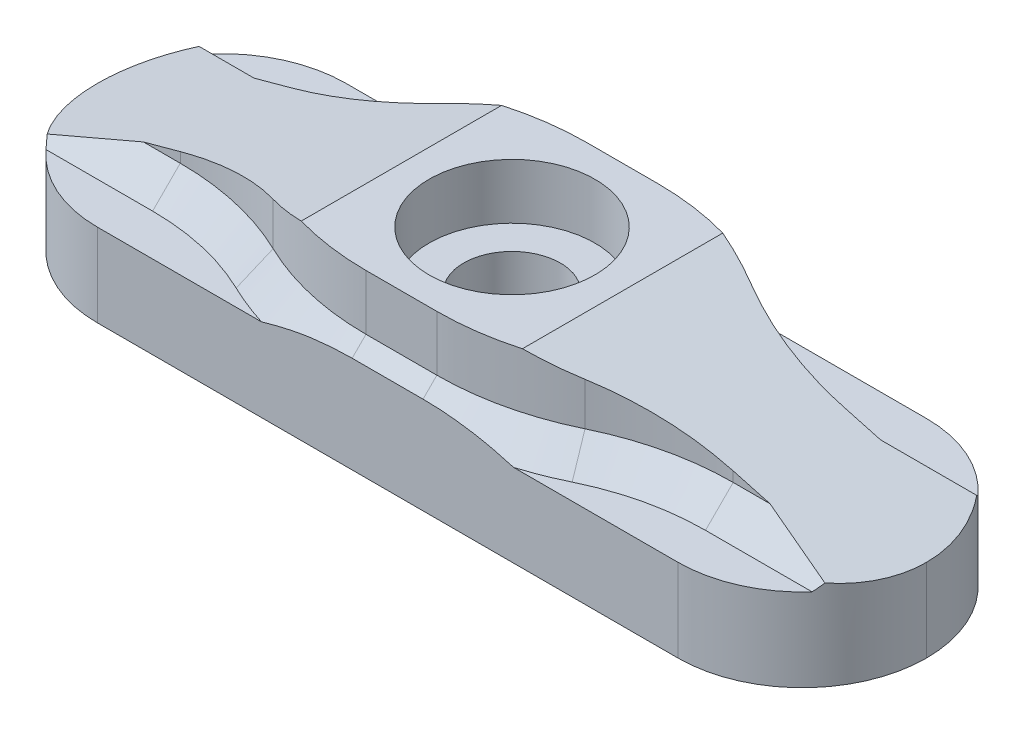
from build123d import *

# Parameters (mm, degrees)
SKETCH1_W                = 30
SKETCH1_H                = 9
BOSS_EXTRUDE1_DEPTH      = 3
BOSS_EXTRUDE2_DEPTH      = 4
BOSS_EXTRUDE2_DEPTH_BACK = 4
SKETCH3_W                = 11
SKETCH3_H                = 2
CUT_EXTRUDE1_DEPTH       = 3
SKETCH5_R                = 1.75
CUT_EXTRUDE2_DEPTH       = 14
SKETCH6_R                = 3
CUT_EXTRUDE3_DEPTH       = 2
FILLET1_R                = 10
FILLET2_R                = 10
CHAMFER1_SIZE            = 1
FILLET3_R                = 4.5


with BuildPart() as part:
    # Sketch1 → Boss-Extrude1 (new body)
    with BuildSketch(Plane(origin=(0, 0, 0), x_dir=(1, 0, 0), z_dir=(0, 1, 0))):
        Rectangle(SKETCH1_W, SKETCH1_H)
    extrude(amount=BOSS_EXTRUDE1_DEPTH)

    # Sketch2 → Boss-Extrude2 (add, two sides: drawn at the far end of the back side and taken through both)
    with BuildSketch(Plane.XY.offset(-BOSS_EXTRUDE2_DEPTH_BACK)):
        Polygon((-15, 3), (-4, 6), (4, 6), (15, 3), align=None)
    extrude(amount=BOSS_EXTRUDE2_DEPTH + BOSS_EXTRUDE2_DEPTH_BACK)

    # Sketch3 → Cut-Extrude1 (cut)
    with BuildSketch(Plane(origin=(0, 6, 0), x_dir=(1, 0, 0), z_dir=(0, 1, 0))):
        with Locations((9.5, 3)):
            Rectangle(SKETCH3_W, SKETCH3_H)
        with Locations((-9.5, 3)):
            Rectangle(SKETCH3_W, SKETCH3_H)
        with Locations((-9.5, -3)):
            Rectangle(SKETCH3_W, SKETCH3_H)
        with Locations((9.5, -3)):
            Rectangle(SKETCH3_W, SKETCH3_H)
    extrude(amount=-CUT_EXTRUDE1_DEPTH, mode=Mode.SUBTRACT)

    # Sketch5 → Cut-Extrude2 (cut)
    with BuildSketch(Plane(origin=(0, 6, 0), x_dir=(1, 0, 0), z_dir=(0, 1, 0))):
        with Locations(Location((0, 0, 0), (0, 0, 270))):
            Circle(SKETCH5_R)
    extrude(amount=-CUT_EXTRUDE2_DEPTH, mode=Mode.SUBTRACT)

    # Sketch6 → Cut-Extrude3 (cut)
    with BuildSketch(Plane(origin=(0, 6, 0), x_dir=(1, 0, 0), z_dir=(0, 1, 0))):
        with Locations(Location((0, 0, 0), (0, 0, 270))):
            Circle(SKETCH6_R)
    extrude(amount=-CUT_EXTRUDE3_DEPTH, mode=Mode.SUBTRACT)

    # Fillet1
    # the kernel refuses this fillet: 10 mm, written as the material it adds along each edge
    with BuildSketch(Plane(origin=(-4, 21, -2), x_dir=(-1, 0, 0), z_dir=(0, -1, 0))) as fillet1_piece_1_section:
        with BuildLine():
            CenterArc((6, 10), FILLET1_R, 233.130102354, 36.869897646)
            Line((0, 2), (0, 0))
            Line((0, 0), (6, 0))
        make_face()
    fillet1_piece_1 = extrude(amount=18, mode=Mode.PRIVATE)
    fillet1_piece_1 = split(fillet1_piece_1, bisect_by=Plane(origin=(-0.192307692, 7.038461538, -2), z_dir=(0.2631174057921088, -0.9647638212377322, 0)), keep=Keep.TOP, mode=Mode.PRIVATE)
    add(fillet1_piece_1)
    with BuildSketch(Plane(origin=(4, 21, -2), x_dir=(0, 0, -1), z_dir=(0, -1, 0))) as fillet1_piece_2_section:
        with BuildLine():
            CenterArc((10, 6), FILLET1_R, 180, 36.869897646)
            Line((0, 6), (0, 0))
            Line((0, 0), (2, 0))
        make_face()
    fillet1_piece_2 = extrude(amount=18, mode=Mode.PRIVATE)
    fillet1_piece_2 = split(fillet1_piece_2, bisect_by=Plane(origin=(0.192307692, 7.038461538, -2), z_dir=(-0.2631174057921089, -0.9647638212377321, 0)), keep=Keep.TOP, mode=Mode.PRIVATE)
    add(fillet1_piece_2)
    with BuildSketch(Plane(origin=(4, 21, 2), x_dir=(1, 0, 0), z_dir=(0, -1, 0))) as fillet1_piece_3_section:
        with BuildLine():
            CenterArc((6, 10), FILLET1_R, 233.130102354, 36.869897646)
            Line((0, 2), (0, 0))
            Line((0, 0), (6, 0))
        make_face()
    fillet1_piece_3 = extrude(amount=18, mode=Mode.PRIVATE)
    fillet1_piece_3 = split(fillet1_piece_3, bisect_by=Plane(origin=(0.192307692, 7.038461538, 2), z_dir=(-0.2631174057921089, -0.9647638212377321, 0)), keep=Keep.TOP, mode=Mode.PRIVATE)
    add(fillet1_piece_3)
    with BuildSketch(Plane(origin=(-4, 21, 2), x_dir=(0, 0, 1), z_dir=(0, -1, 0))) as fillet1_piece_4_section:
        with BuildLine():
            CenterArc((10, 6), FILLET1_R, 180, 36.869897646)
            Line((0, 6), (0, 0))
            Line((0, 0), (2, 0))
        make_face()
    fillet1_piece_4 = extrude(amount=18, mode=Mode.PRIVATE)
    fillet1_piece_4 = split(fillet1_piece_4, bisect_by=Plane(origin=(-0.192307692, 7.038461538, 2), z_dir=(0.2631174057921088, -0.9647638212377322, 0)), keep=Keep.TOP, mode=Mode.PRIVATE)
    add(fillet1_piece_4)

    # Fillet2
    fillet2_edges = [part.edges().sort_by_distance(p)[0] for p in [
        (-4, 4.5, -4),
        (4, 4.5, -4),
        (4, 4.5, 4),
        (-4, 4.5, 4),
    ]]
    fillet(fillet2_edges, radius=FILLET2_R)

    # Chamfer1
    # the kernel refuses this chamfer: 1 mm, written as the material it adds along each edge
    with BuildSketch(Plane(origin=(1.282202113, 3, -4), x_dir=(0, 1, 0), z_dir=(-1, 0, 0))) as chamfer1_piece_1_section:
        Polygon((CHAMFER1_SIZE, 0), (0, CHAMFER1_SIZE), (0, 0), align=None)
    chamfer1_piece_1 = extrude(amount=2.564404226, mode=Mode.PRIVATE)
    chamfer1_piece_1 = split(chamfer1_piece_1, bisect_by=Plane(origin=(1.282202113, 3, -4.5), z_dir=(0, 0, 1)), keep=Keep.TOP, mode=Mode.PRIVATE)
    add(chamfer1_piece_1)
    with BuildSketch(Plane(origin=(10, 3, -12), x_dir=(0, 0, 1), z_dir=(1, 0, 0))) as chamfer1_piece_2:
        Polygon((10 - CHAMFER1_SIZE, 0), (10, -CHAMFER1_SIZE), (10, 0), align=None)
    revolve(axis=Axis((10, 3, -12), (0, -1, 0)), revolution_arc=25.841932763)
    with BuildSketch(Plane(origin=(1.282202113, 3, 4), x_dir=(0, 0, 1), z_dir=(-1, 0, 0))) as chamfer1_piece_3_section:
        Polygon((CHAMFER1_SIZE, 0), (0, CHAMFER1_SIZE), (0, 0), align=None)
    chamfer1_piece_3 = extrude(amount=2.564404226, mode=Mode.PRIVATE)
    chamfer1_piece_3 = split(chamfer1_piece_3, bisect_by=Plane(origin=(1.282202113, 3, 4.5), z_dir=(0, 0, -1)), keep=Keep.TOP, mode=Mode.PRIVATE)
    add(chamfer1_piece_3)
    with BuildSketch(Plane(origin=(-10, 3, 12), x_dir=(0, 0, -1), z_dir=(-1, 0, 0))) as chamfer1_piece_4:
        Polygon((10, -CHAMFER1_SIZE), (10 - CHAMFER1_SIZE, 0), (10, 0), align=None)
    revolve(axis=Axis((-10, 3, 12), (0, -1, 0)), revolution_arc=25.841932763)
    with BuildSketch(Plane(origin=(-1.282202113, 3, 6), x_dir=(0, 0, -1), z_dir=(1, 0, 0))) as chamfer1_piece_5_section:
        Polygon((10, CHAMFER1_SIZE), (10 + CHAMFER1_SIZE, 0), (10, 0), align=None)
    chamfer1_piece_5 = revolve(axis=Axis((-1.282202113, 3, 6), (0, 1, 0)), revolution_arc=25.841932763, mode=Mode.PRIVATE)
    chamfer1_piece_5 = split(chamfer1_piece_5, bisect_by=Plane(origin=(-1.282202113, 3, -4.5), z_dir=(0, 0, 1)), keep=Keep.TOP, mode=Mode.PRIVATE)
    add(chamfer1_piece_5)
    with BuildSketch(Plane(origin=(1.282202113, 3, 6), x_dir=(0, 0, -1), z_dir=(-1, 0, 0))) as chamfer1_piece_6_section:
        Polygon((10, -CHAMFER1_SIZE), (10 + CHAMFER1_SIZE, 0), (10, 0), align=None)
    chamfer1_piece_6 = revolve(axis=Axis((1.282202113, 3, 6), (0, -1, 0)), revolution_arc=25.841932763, mode=Mode.PRIVATE)
    chamfer1_piece_6 = split(chamfer1_piece_6, bisect_by=Plane(origin=(1.282202113, 3, -4.5), z_dir=(0, 0, 1)), keep=Keep.TOP, mode=Mode.PRIVATE)
    add(chamfer1_piece_6)
    with BuildSketch(Plane(origin=(1.282202113, 3, -6), x_dir=(0.43588989435406694, 0, 0.9000000000000001), z_dir=(0.9000000000000001, 0, -0.43588989435406694))) as chamfer1_piece_7_section:
        Polygon((10 + CHAMFER1_SIZE, 0), (10, -CHAMFER1_SIZE), (10, 0), align=None)
    chamfer1_piece_7 = revolve(axis=Axis((1.282202113, 3, -6), (0, -1, 0)), revolution_arc=25.841932763, mode=Mode.PRIVATE)
    chamfer1_piece_7 = split(chamfer1_piece_7, bisect_by=Plane(origin=(1.282202113, 3, 4.5), z_dir=(0, 0, -1)), keep=Keep.TOP, mode=Mode.PRIVATE)
    add(chamfer1_piece_7)
    with BuildSketch(Plane(origin=(-1.282202113, 3, -6), x_dir=(-0.4358898943539643, 0, 0.9000000000000499), z_dir=(-0.9000000000000499, 0, -0.4358898943539643))) as chamfer1_piece_8_section:
        Polygon((10, CHAMFER1_SIZE), (10 + CHAMFER1_SIZE, 0), (10, 0), align=None)
    chamfer1_piece_8 = revolve(axis=Axis((-1.282202113, 3, -6), (0, 1, 0)), revolution_arc=25.841932763, mode=Mode.PRIVATE)
    chamfer1_piece_8 = split(chamfer1_piece_8, bisect_by=Plane(origin=(-1.282202113, 3, 4.5), z_dir=(0, 0, -1)), keep=Keep.TOP, mode=Mode.PRIVATE)
    add(chamfer1_piece_8)
    with BuildSketch(Plane(origin=(-10, 3, 2), x_dir=(0, 1, 0), z_dir=(-1, 0, 0))) as chamfer1_piece_9_section:
        Polygon((CHAMFER1_SIZE, 0), (0, -CHAMFER1_SIZE), (0, 0), align=None)
    chamfer1_piece_9 = extrude(amount=5, mode=Mode.PRIVATE)
    chamfer1_piece_9 = split(chamfer1_piece_9, bisect_by=Plane(origin=(-10.346153846, 4.269230769, 2), z_dir=(0.2631174057919396, -0.9647638212377784, 0)), keep=Keep.TOP, mode=Mode.PRIVATE)
    add(chamfer1_piece_9)
    with BuildSketch(Plane(origin=(10, 3, -2), x_dir=(0, 0, -1), z_dir=(1, 0, 0))) as chamfer1_piece_10_section:
        Polygon((CHAMFER1_SIZE, 0), (0, CHAMFER1_SIZE), (0, 0), align=None)
    chamfer1_piece_10 = extrude(amount=5, mode=Mode.PRIVATE)
    chamfer1_piece_10 = split(chamfer1_piece_10, bisect_by=Plane(origin=(10.346153846, 4.269230769, -2), z_dir=(-0.2631174057919396, -0.9647638212377784, 0)), keep=Keep.TOP, mode=Mode.PRIVATE)
    add(chamfer1_piece_10)
    with BuildSketch(Plane(origin=(-15, 3, -2), x_dir=(0, 1, 0), z_dir=(1, 0, 0))) as chamfer1_piece_11_section:
        Polygon((CHAMFER1_SIZE, 0), (0, -CHAMFER1_SIZE), (0, 0), align=None)
    chamfer1_piece_11 = extrude(amount=5, mode=Mode.PRIVATE)
    chamfer1_piece_11 = split(chamfer1_piece_11, bisect_by=Plane(origin=(-15, 3, -2), z_dir=(0.2631174057919396, -0.9647638212377784, 0)), keep=Keep.TOP, mode=Mode.PRIVATE)
    add(chamfer1_piece_11)
    with BuildSketch(Plane(origin=(-10, 3, -12), x_dir=(0.43588989435406783, 0, 0.8999999999999998), z_dir=(0.8999999999999998, 0, -0.43588989435406783))) as chamfer1_piece_12:
        Polygon((10, -CHAMFER1_SIZE), (10 - CHAMFER1_SIZE, 0), (10, 0), align=None)
    revolve(axis=Axis((-10, 3, -12), (0, -1, 0)), revolution_arc=25.841932763)
    with BuildSketch(Plane(origin=(15, 3, 2), x_dir=(0, 0, 1), z_dir=(-1, 0, 0))) as chamfer1_piece_13_section:
        Polygon((CHAMFER1_SIZE, 0), (0, CHAMFER1_SIZE), (0, 0), align=None)
    chamfer1_piece_13 = extrude(amount=5, mode=Mode.PRIVATE)
    chamfer1_piece_13 = split(chamfer1_piece_13, bisect_by=Plane(origin=(15, 3, 2), z_dir=(-0.2631174057919396, -0.9647638212377784, 0)), keep=Keep.TOP, mode=Mode.PRIVATE)
    add(chamfer1_piece_13)
    with BuildSketch(Plane(origin=(10, 3, 12), x_dir=(-0.43588989435406783, 0, -0.8999999999999998), z_dir=(-0.8999999999999998, 0, 0.43588989435406783))) as chamfer1_piece_14:
        Polygon((10 - CHAMFER1_SIZE, 0), (10, -CHAMFER1_SIZE), (10, 0), align=None)
    revolve(axis=Axis((10, 3, 12), (0, -1, 0)), revolution_arc=25.841932763)

    # Fillet3
    # the kernel refuses this fillet: 4.5 mm, written as the material it takes off along each edge
    with BuildSketch(Plane(origin=(15, -11.25, -4.5), x_dir=(0, 0, 1), z_dir=(0, 1, 0)), Plane(origin=(-15, -11.25, -4.5), x_dir=(1, 0, 0), z_dir=(0, 1, 0))) as fillet3_piece_1:
        with BuildLine():
            CenterArc((FILLET3_R, -FILLET3_R), FILLET3_R, 90, 90)
            Line((0, -FILLET3_R), (0, 0))
            Line((0, 0), (FILLET3_R, 0))
        make_face()
    extrude(amount=25.5, mode=Mode.SUBTRACT)
    with BuildSketch(Plane(origin=(15, -11.25, 4.5), x_dir=(0, 0, -1), z_dir=(0, 1, 0)), Plane(origin=(-15, -11.25, 4.5), x_dir=(1, 0, 0), z_dir=(0, 1, 0))) as fillet3_piece_2:
        with BuildLine():
            CenterArc((FILLET3_R, FILLET3_R), FILLET3_R, 180, 90)
            Line((0, FILLET3_R), (0, 0))
            Line((0, 0), (FILLET3_R, 0))
        make_face()
    extrude(amount=25.5, mode=Mode.SUBTRACT)


solid = part.part
